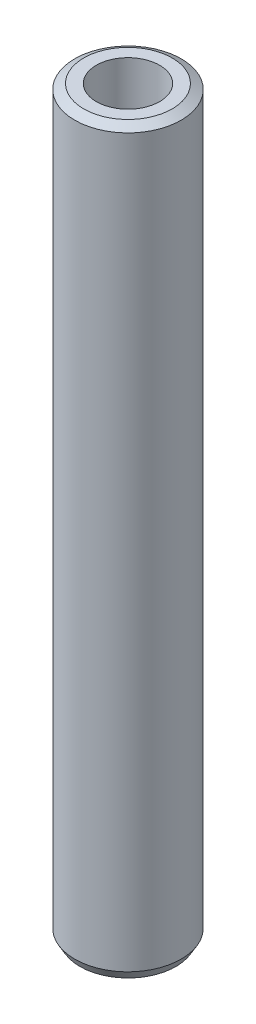
from build123d import *
from OCP.BRepFilletAPI import BRepFilletAPI_MakeChamfer

# Parameters (mm, degrees)
SKETCH1_R           = 30
BOSS_EXTRUDE1_DEPTH = 417.483825445
SKETCH2_R           = 17.810534198
CUT_EXTRUDE1_DEPTH  = 420.634060234
CHAMFER1_SIZE       = 2.94417535
CHAMFER1_SIZE2      = 5.099461293


with BuildPart() as part:
    # Sketch1 → Boss-Extrude1 (new body)
    with BuildSketch(Plane(origin=(0, 0, 0), x_dir=(1, 0, 0), z_dir=(0, 1, 0))):
        Circle(SKETCH1_R)
    extrude(amount=BOSS_EXTRUDE1_DEPTH)

    # Sketch2 → Cut-Extrude1 (cut, through all)
    with BuildSketch(Plane(origin=(0, 0, 0), x_dir=(1, 0, 0), z_dir=(0, 1, 0))):
        Circle(SKETCH2_R)
    extrude(amount=CUT_EXTRUDE1_DEPTH, mode=Mode.SUBTRACT)

    # Chamfer1: one chamfer whose edges measure the first distance from different faces: ONE call of the kernel's chamfer builder (chamfer() names one face for all edges)
    chamfer1_edges_1 = [part.edges().sort_by_distance(p)[0] for p in [
        (-30, 417.483825445, 0),
    ]]
    chamfer1_side_1 = [part.faces().sort_by_distance(p)[0] for p in [
        (-30, 208.741912723, 0),
    ]]
    chamfer1_edges_2 = [part.edges().sort_by_distance(p)[0] for p in [
        (-30, 0, 0),
    ]]
    chamfer1_side_2 = [part.faces().sort_by_distance(p)[0] for p in [
        (-29.151471863, 0, 0),
    ]]
    chamfer1 = BRepFilletAPI_MakeChamfer(part.part.solid().wrapped)
    for e in chamfer1_edges_1:
        chamfer1.Add(CHAMFER1_SIZE, CHAMFER1_SIZE2, e.wrapped, chamfer1_side_1[0].wrapped)  # the first distance lies on this face
    for e in chamfer1_edges_2:
        chamfer1.Add(CHAMFER1_SIZE, CHAMFER1_SIZE2, e.wrapped, chamfer1_side_2[0].wrapped)  # the first distance lies on this face
    add(Compound.cast(chamfer1.Shape()), mode=Mode.REPLACE)


solid = part.part
